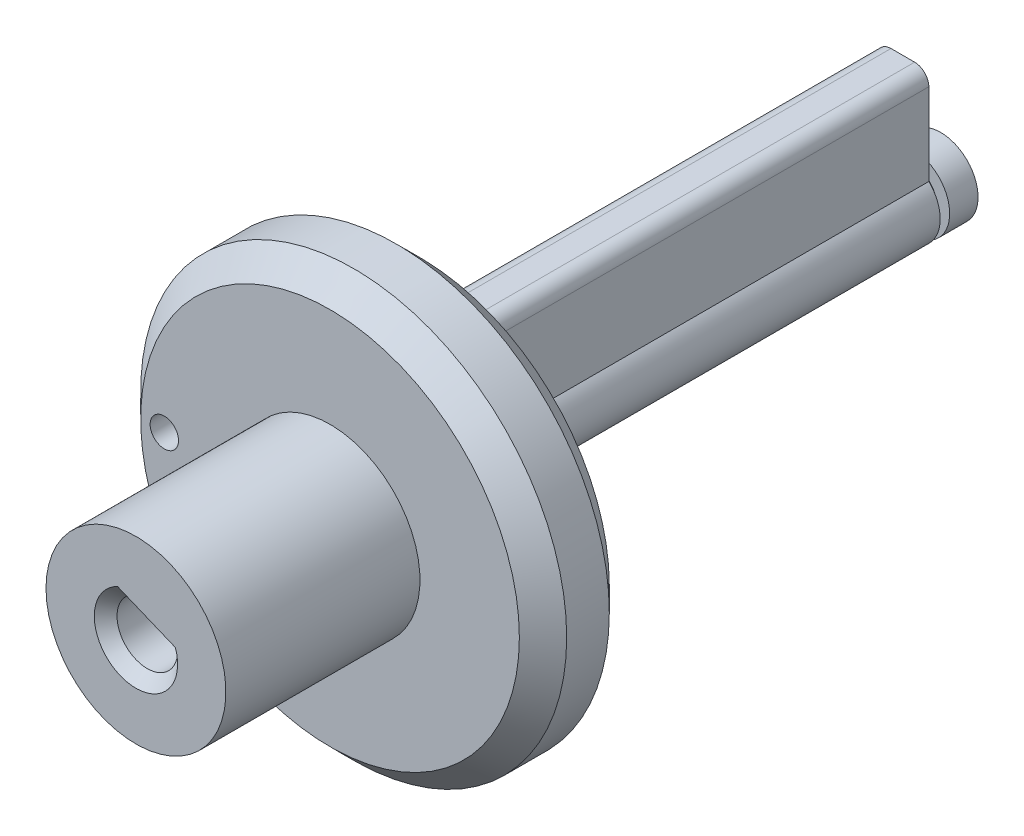
from build123d import *
from build123d.topology import SkipClean

# Parameters (mm, degrees)
EXTRUDE1_DEPTH               = 0.000254
SKETCH8_R                    = 2.413
EXTRUDE8_DEPTH               = 7.62
SKETCH6_R                    = 5.715
EXTRUDE6_DEPTH               = 2.413
SKETCH4_R                    = 0.254
EXTRUDE4_DEPTH               = 6.731
SKETCH5_R                    = 1.0033
EXTRUDE5_DEPTH               = 12.954
FILLET2_R                    = 0.889
CHAMFER1_SIZE                = 0.635
CHAMFER3_SIZE                = 0.635
EXTRUDE9_DEPTH               = 12.954
EXTRUDE11_DEPTH              = 6.731
CIRPATTERN1_COUNT            = 8
EXTRUDE12_DEPTH              = 6.731
CHAMFER4_SIZE                = 0.381
CHAMFER4_SIZE2               = 0.659911358
EXTRUDE13_DEPTH              = 0.6604
CUT_REVOLVE1_ANGLE           = 130
CUT_REVOLVE1_OTHER_WAY_ANGLE = 90
BOSS_EXTRUDE1_DEPTH          = 6.071088642
CUT_EXTRUDE1_DEPTH           = 0.838688642
CHAMFER5_SIZE                = 0.1016
CHAMFER6_SIZE                = 0.3048
SKETCH27_R                   = 0.381
CUT_EXTRUDE5_DEPTH           = 16.268548261
CUT_EXTRUDE7_DEPTH           = 1.27
SKETCH29_R                   = 0.6604
BOSS_EXTRUDE2_DEPTH          = 1.016
BOSS_EXTRUDE3_START          = -0.762
SKETCH30_R                   = 1.0033
BOSS_EXTRUDE3_DEPTH          = 0.762


with BuildPart() as part:
    # Sketch1 → Extrude1 (new body)
    with BuildSketch(Plane.XY):
        with BuildLine():
            Line((-1.242889362, 3.556), (-1.813523477, 0.319773119))
            ThreePointArc((-1.813523477, 0.319773119), (0, -1.8415), (1.813523477, 0.319773119))
            Line((1.813523477, 0.319773119), (1.242889362, 3.556))
            Line((1.242889362, 3.556), (-1.242889362, 3.556))
        make_face()
    extrude(amount=EXTRUDE1_DEPTH)

    # Sketch8 → Extrude8 (add)
    with BuildSketch(Plane.XY.offset(0.000254)):
        with Locations(Location((0, 0, 0), (0, 0, 129.743387424))):
            Circle(SKETCH8_R)
    extrude(amount=EXTRUDE8_DEPTH)

    # Sketch6 → Extrude6 (add)
    with BuildSketch(Plane.XY.offset(0.000254)):
        Circle(SKETCH6_R)
    extrude(amount=EXTRUDE6_DEPTH)

    # Sketch4 → Extrude4 (cut)
    with BuildSketch(Plane.XY.offset(7.620254)):
        Circle(SKETCH4_R)
    extrude(amount=-EXTRUDE4_DEPTH, mode=Mode.SUBTRACT)

    # Sketch5 → Extrude5 (add)
    with BuildSketch(Plane(origin=(0, 0, 0), x_dir=(-1, 0, 0), z_dir=(0, 0, -1))):
        with Locations(Location((0, 0, 0), (0, 0, 180))):
            Circle(SKETCH5_R)
    extrude(amount=EXTRUDE5_DEPTH)

    # Fillet2
    fillet2_edges = [part.edges().sort_by_distance(p)[0] for p in [
        (1.242889362, 3.556, 0.000127),
        (-1.242889362, 3.556, 0.000127),
    ]]
    fillet(fillet2_edges, radius=FILLET2_R)

    # Chamfer1
    chamfer1_edges = [part.edges().sort_by_distance(p)[0] for p in [
        (-5.715, 0, 0.000254),
    ]]
    chamfer(chamfer1_edges, length=CHAMFER1_SIZE)

    # Chamfer3
    chamfer3_edges = [part.edges().sort_by_distance(p)[0] for p in [
        (-5.715, 0, 2.413254),
    ]]
    chamfer(chamfer3_edges, length=CHAMFER3_SIZE)

    # Sketch9 → Extrude9 (add)
    with BuildSketch(Plane(origin=(0, 0, 0), x_dir=(-1, 0, 0), z_dir=(0, 0, -1))):
        with BuildLine():
            Line((-0.3175, 3.302), (0.3175, 3.302))
            ThreePointArc((0.3175, 3.302), (0.586907684, 3.190407684), (0.6985, 2.921))
            Line((0.6985, 2.921), (0.6985, 0))
            Line((0.6985, 0), (-0.6985, 0))
            Line((-0.6985, 0), (-0.6985, 2.921))
            ThreePointArc((-0.6985, 2.921), (-0.586907684, 3.190407684), (-0.3175, 3.302))
        make_face()
    extrude(amount=EXTRUDE9_DEPTH)

    # Sketch17 → Extrude11 (cut)
    with BuildSketch(Plane.XY.offset(7.620254)):
        with BuildLine():
            Line((0, 0), (0, 0.8128))
            ThreePointArc((0, 0.8128), (0.077181384, 0.80912723), (0.153665255, 0.798142111))
            ThreePointArc((0.153665255, 0.798142111), (0.281884616, 0.680529664), (0.455713955, 0.673029443))
            ThreePointArc((0.455713955, 0.673029443), (0.517563871, 0.626714831), (0.574736392, 0.574736392))
            Line((0.574736392, 0.574736392), (0, 0))
        make_face()
    extrude11 = extrude(amount=-EXTRUDE11_DEPTH, mode=Mode.SUBTRACT)

    # CirPattern1: Extrude11 ×8 about axis
    cirpattern1_axis = Axis((0, 0, 0), (0, 0, 1))
    for i in range(1, CIRPATTERN1_COUNT):
        add(extrude11.rotate(cirpattern1_axis, i * 360 / CIRPATTERN1_COUNT), mode=Mode.SUBTRACT)

    # Sketch18 → Extrude12 (add)
    with BuildSketch(Plane.XY.offset(7.620254)):
        Polygon((-0.539167209, 0.608229037), (0.811331666, 0.048834087), (0.986294531, 0.471231809), (-0.364204343, 1.030626759), align=None)
    extrude(amount=-EXTRUDE12_DEPTH)

    # Chamfer4
    chamfer4_edges = [part.edges().sort_by_distance(p)[0] for p in [
        (0.136082229, 0.328531562, 7.620254),
    ]]
    chamfer4_side = [part.faces().sort_by_distance(p)[0] for p in [
        (1.499116567, -1.802914954, 7.620254),
    ]]
    chamfer(chamfer4_edges, length=CHAMFER4_SIZE, length2=CHAMFER4_SIZE2, reference=chamfer4_side[0])

    # Sketch19 → Extrude13 (cut)
    with SkipClean():  # the faces are left unmerged after this step: merging them gives an invalid solid
        with BuildSketch(Plane.XY.offset(7.620254)):
            with BuildLine():
                Line((0.811331666, 0.048834087), (-0.539167209, 0.608229037))
                ThreePointArc((-0.539167209, 0.608229037), (-0.311045094, -0.750929284), (0.811331666, 0.048834087))
            make_face()
        extrude(amount=-EXTRUDE13_DEPTH, mode=Mode.SUBTRACT)

    # Sketch20 → Cut-Revolve1 (revolve, cut)
    with SkipClean():  # the faces are left unmerged after this step: merging them gives an invalid solid
        with BuildSketch(Plane(origin=(0, 0, 0), x_dir=(0, 0, -1), z_dir=(1, 0, 0))):
            Polygon((-6.959854, -0.8128), (-6.959854, 0), (-6.147054, 0), align=None)
        revolve(axis=Axis((0, 0, 7.389643883), (0, 0, -1)), revolution_arc=CUT_REVOLVE1_ANGLE, mode=Mode.SUBTRACT)

    # Sketch20 → Cut-Revolve1 other way (revolve, cut)
    with SkipClean():  # the faces are left unmerged after this step: merging them gives an invalid solid
        with BuildSketch(Plane(origin=(0, 0, 0), x_dir=(0, 0, -1), z_dir=(1, 0, 0))):
            Polygon((-6.959854, -0.8128), (-6.959854, 0), (-6.147054, 0), align=None)
        revolve(axis=Axis((0, 0, 7.389643883), (0, 0, 1)), revolution_arc=CUT_REVOLVE1_OTHER_WAY_ANGLE, mode=Mode.SUBTRACT)

    # Sketch21 → Boss-Extrude1 (add)
    with SkipClean():  # the faces are left unmerged after this step: merging them gives an invalid solid
        with BuildSketch(Plane.XY.offset(6.960342642)):
            with BuildLine():
                Line((-0.459893976, 0.575392988), (-0.539167209, 0.608229037))
                ThreePointArc((-0.539167209, 0.608229037), (-0.311045094, -0.750929284), (0.811331666, 0.048834087))
                Line((0.811331666, 0.048834087), (0.732058433, 0.081670135))
                ThreePointArc((0.732058433, 0.081670135), (-0.281884616, -0.680529664), (-0.459893976, 0.575392988))
            make_face()
        extrude(amount=-BOSS_EXTRUDE1_DEPTH)

    # Sketch22 → Cut-Extrude1 (cut)
    with SkipClean():  # the faces are left unmerged after this step: merging them gives an invalid solid
        with BuildSketch(Plane.XY.offset(6.960342642)):
            with BuildLine():
                Line((-0.459893976, 0.575392988), (-0.539167209, 0.608229037))
                ThreePointArc((-0.539167209, 0.608229037), (-0.311045094, -0.750929284), (0.811331666, 0.048834087))
                Line((0.811331666, 0.048834087), (0.732058433, 0.081670135))
                ThreePointArc((0.732058433, 0.081670135), (-0.281884616, -0.680529664), (-0.459893976, 0.575392988))
            make_face()
        extrude(amount=-CUT_EXTRUDE1_DEPTH, mode=Mode.SUBTRACT)

    # Chamfer5
    # the kernel refuses this chamfer: 0.1016 mm, written as the material it takes off along each edge
    with BuildSketch(Plane(origin=(0, 0, 6.121654), x_dir=(-0.3826834323650876, -0.9238795325112875, 0), z_dir=(0.9238795325112875, -0.3826834323650876, 0))) as chamfer5_piece_1_section:
        Polygon((0.7366 + CHAMFER5_SIZE, 0), (0.7366, CHAMFER5_SIZE), (0.7366, 0), align=None)
    chamfer5_piece_1 = revolve(axis=Axis((0, 0, 6.121654), (0, 0, -1)), revolution_arc=45, mode=Mode.PRIVATE)
    chamfer5_piece_1 = chamfer5_piece_1 & Plane(origin=(0, 0, 6.086219336), x_dir=(-0.6633454831704748, 0.74831328329606, 0), z_dir=(0, 0, 1)) * Cylinder(0.8128, 4, mode=Mode.PRIVATE)
    add(chamfer5_piece_1, mode=Mode.SUBTRACT)
    with BuildSketch(Plane(origin=(0, 0, 6.121654), x_dir=(0.3826834323650712, -0.9238795325112945, 0), z_dir=(0.9238795325112945, 0.3826834323650712, 0))) as chamfer5_piece_2_section:
        Polygon((0.7366 + CHAMFER5_SIZE, 0), (0.7366, CHAMFER5_SIZE), (0.7366, 0), align=None)
    chamfer5_piece_2 = revolve(axis=Axis((0, 0, 6.121654), (0, 0, -1)), revolution_arc=45, mode=Mode.PRIVATE)
    chamfer5_piece_2 = chamfer5_piece_2 & Plane(origin=(0, 0, 6.086219336), x_dir=(-0.6633454831704748, 0.74831328329606, 0), z_dir=(0, 0, 1)) * Cylinder(0.8128, 4, mode=Mode.PRIVATE)
    add(chamfer5_piece_2, mode=Mode.SUBTRACT)
    with BuildSketch(Plane(origin=(0, 0, 6.121654), x_dir=(-0.9238795325112938, -0.3826834323650728, 0), z_dir=(0.3826834323650728, -0.9238795325112938, 0))) as chamfer5_piece_3_section:
        Polygon((0.7366 + CHAMFER5_SIZE, 0), (0.7366, CHAMFER5_SIZE), (0.7366, 0), align=None)
    chamfer5_piece_3 = revolve(axis=Axis((0, 0, 6.121654), (0, 0, -1)), revolution_arc=45, mode=Mode.PRIVATE)
    chamfer5_piece_3 = chamfer5_piece_3 & Plane(origin=(0, 0, 6.086219336), x_dir=(-0.6633454831704748, 0.74831328329606, 0), z_dir=(0, 0, 1)) * Cylinder(0.8128, 4, mode=Mode.PRIVATE)
    add(chamfer5_piece_3, mode=Mode.SUBTRACT)
    with BuildSketch(Plane(origin=(0, 0, 6.121654), x_dir=(-0.9238795325112764, 0.3826834323651145, 0), z_dir=(-0.3826834323651145, -0.9238795325112764, 0))) as chamfer5_piece_4_section:
        Polygon((0.7366 + CHAMFER5_SIZE, 0), (0.7366, CHAMFER5_SIZE), (0.7366, 0), align=None)
    chamfer5_piece_4 = revolve(axis=Axis((0, 0, 6.121654), (0, 0, -1)), revolution_arc=49.190233443, mode=Mode.PRIVATE)
    chamfer5_piece_4 = chamfer5_piece_4 & Plane(origin=(0, 0, 6.085867455), x_dir=(-0.6633454831704748, 0.74831328329606, 0), z_dir=(0, 0, 1)) * Cylinder(0.8128, 4, mode=Mode.PRIVATE)
    chamfer5_piece_4 = split(chamfer5_piece_4, bisect_by=Plane(origin=(-0.544175649, 0.610303601, 6.085867455), z_dir=(-0.38268343236508656, -0.9238795325112882, 0)), keep=Keep.TOP, mode=Mode.PRIVATE)
    add(chamfer5_piece_4, mode=Mode.SUBTRACT)
    with BuildSketch(Plane(origin=(0, 0, 6.121654), x_dir=(0.9238795325112772, -0.3826834323651127, 0), z_dir=(0.3826834323651127, 0.9238795325112772, 0))) as chamfer5_piece_5_section:
        Polygon((0.7366 + CHAMFER5_SIZE, 0), (0.7366, CHAMFER5_SIZE), (0.7366, 0), align=None)
    chamfer5_piece_5 = revolve(axis=Axis((0, 0, 6.121654), (0, 0, -1)), revolution_arc=45, mode=Mode.PRIVATE)
    chamfer5_piece_5 = chamfer5_piece_5 & Plane(origin=(0, 0, 6.086219336), x_dir=(-0.6633454831704748, 0.74831328329606, 0), z_dir=(0, 0, 1)) * Cylinder(0.8128, 4, mode=Mode.PRIVATE)
    add(chamfer5_piece_5, mode=Mode.SUBTRACT)
    with BuildSketch(Plane(origin=(0, 0, 6.121654), x_dir=(0.8934479656215565, 0.44916670928142266, 0), z_dir=(-0.44916670928142266, 0.8934479656215565, 0))) as chamfer5_piece_6_section:
        Polygon((0.7366 + CHAMFER5_SIZE, 0), (0.7366, CHAMFER5_SIZE), (0.7366, 0), align=None)
    chamfer5_piece_6 = revolve(axis=Axis((0, 0, 6.121654), (0, 0, -1)), revolution_arc=49.190233443, mode=Mode.PRIVATE)
    chamfer5_piece_6 = chamfer5_piece_6 & Plane(origin=(0, 0, 6.085867455), x_dir=(-0.6633454831704748, 0.74831328329606, 0), z_dir=(0, 0, 1)) * Cylinder(0.8128, 4, mode=Mode.PRIVATE)
    chamfer5_piece_6 = split(chamfer5_piece_6, bisect_by=Plane(origin=(0.816340106, 0.046759523, 6.085867455), z_dir=(-0.38268343236508556, -0.9238795325112885, 0)), keep=Keep.TOP, mode=Mode.PRIVATE)
    add(chamfer5_piece_6, mode=Mode.SUBTRACT)

    # Chamfer6
    chamfer6_edges = [part.edges().sort_by_distance(p)[0] for p in [
        (-0.311045094, -0.750929284, 7.620254),
    ]]
    chamfer(chamfer6_edges, length=CHAMFER6_SIZE)

    # Sketch27 → Cut-Extrude5 (cut, through all)
    with BuildSketch(Plane.XY):
        with Locations((-4.445, 0)):
            Circle(SKETCH27_R)
    extrude(amount=CUT_EXTRUDE5_DEPTH, mode=Mode.SUBTRACT)

    # Sketch28 → Cut-Extrude7 (cut)
    with BuildSketch(Plane(origin=(0, 0, 0.000254), x_dir=(-1, 0, 0), z_dir=(0, 0, -1))):
        with BuildLine():
            Line((4.445, 1.014677811), (6.190751279, 1.413187392))
            ThreePointArc((6.190751279, 1.413187392), (6.35, 0), (6.190751279, -1.413187392))
            Line((6.190751279, -1.413187392), (4.445, -1.014677811))
            ThreePointArc((4.445, -1.014677811), (3.430322189, 0), (4.445, 1.014677811))
        make_face()
    extrude(amount=-CUT_EXTRUDE7_DEPTH, mode=Mode.SUBTRACT)

    # Sketch29 → Boss-Extrude2 (add)
    with BuildSketch(Plane(origin=(0, 0, -12.954), x_dir=(-1, 0, 0), z_dir=(0, 0, -1))):
        Circle(SKETCH29_R)
    extrude(amount=BOSS_EXTRUDE2_DEPTH)

    # Sketch30 → Boss-Extrude3 (add)
    with BuildSketch(Plane(origin=(0, 0, -13.97), x_dir=(-1, 0, 0), z_dir=(0, 0, -1)).offset(BOSS_EXTRUDE3_START)):
        Circle(SKETCH30_R)
    extrude(amount=BOSS_EXTRUDE3_DEPTH)


solid = part.part
